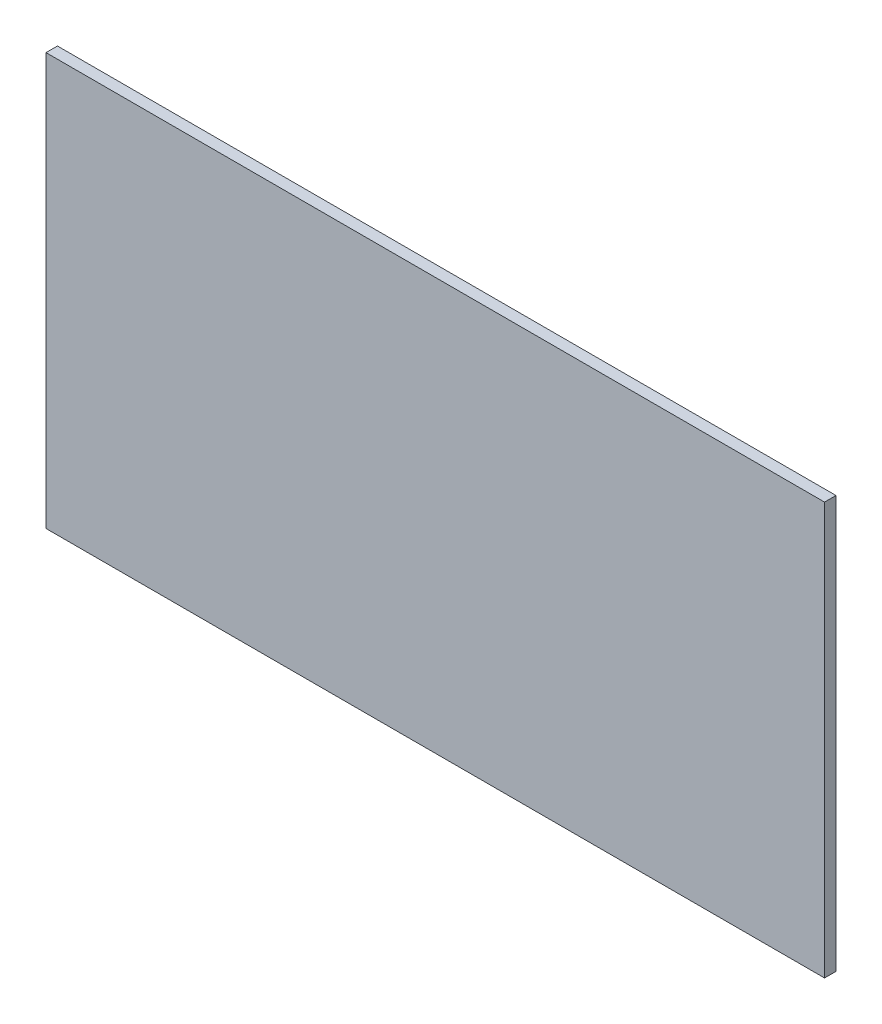
from build123d import *

# Parameters (mm, degrees)
SKETCH1_W           = 107.95
SKETCH1_H           = 57.15
BOSS_EXTRUDE1_DEPTH = 1.5875


with BuildPart() as part:
    # Sketch1 → Boss-Extrude1 (new body)
    with BuildSketch(Plane.XY):
        Rectangle(SKETCH1_W, SKETCH1_H)
    extrude(amount=BOSS_EXTRUDE1_DEPTH)


solid = part.part
